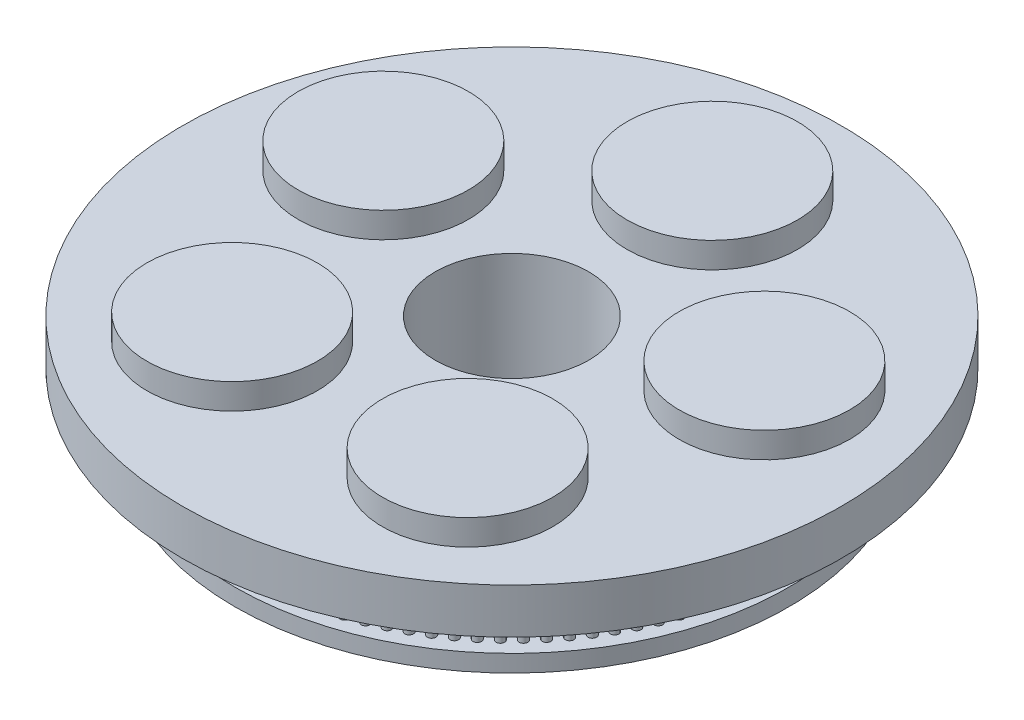
from build123d import *

# Parameters (mm, degrees)
SKETCH_1_R               = 38.66
SKETCH_1_R_2             = 9
EXTRUDE_1_DEPTH          = 5.3
SKETCH_2_R               = 10
EXTRUDE_2_DEPTH          = 3
PATTERN_CIRCULAR_1_COUNT = 5
EXTRUDE_3_DEPTH          = 6
SKETCH_5_R               = 32.5
EXTRUDE_4_DEPTH          = 2
SKETCH_6_R               = 9
CUT_EXTRUDE_1_DEPTH      = 58.051566149


with BuildPart() as part:
    # 草圖1 → 填料-伸長1 (new body)
    with BuildSketch(Plane(origin=(0, 0, 0), x_dir=(1, 0, 0), z_dir=(0, 1, 0))):
        Circle(SKETCH_1_R)
        Circle(SKETCH_1_R_2, mode=Mode.SUBTRACT)
    extrude(amount=EXTRUDE_1_DEPTH)

    # 草圖2 → 填料-伸長2 (add)
    with BuildSketch(Plane(origin=(0, 5.3, 0), x_dir=(1, 0, 0), z_dir=(0, 1, 0))):
        with Locations((0, 23.5)):
            Circle(SKETCH_2_R)
    extrude_2 = extrude(amount=EXTRUDE_2_DEPTH)

    # 環狀複製排列1: 填料-伸長2 ×5 about axis
    pattern_circular_1_axis = Axis((0, 0, 0), (0, 1, 0))
    for i in range(1, PATTERN_CIRCULAR_1_COUNT):
        add(extrude_2.rotate(pattern_circular_1_axis, i * 360 / PATTERN_CIRCULAR_1_COUNT))

    # 草圖4 → 填料-伸長3 (add)
    with BuildSketch(Plane.XZ):
        with BuildLine():
            ThreePointArc((0.5, 30.56), (0, 31.06), (-0.5, 30.56))
            Line((-0.5, 30.56), (-0.5, 30.41))
            ThreePointArc((-0.5, 30.41), (-0.619677877, 30.114749996), (-0.911156829, 29.986160028))
            ThreePointArc((-0.911156829, 29.986160028), (-0.942322772, 29.985196811), (-0.973487698, 29.984201202))
            ThreePointArc((-0.973487698, 29.984201202), (-1.272465713, 30.094235312), (-1.410446335, 30.381388071))
            Line((-1.410446335, 30.381388071), (-1.419864913, 30.531092081))
            ThreePointArc((-1.419864913, 30.531092081), (-1.950273537, 30.998710185), (-2.417891641, 30.468301561))
            Line((-2.417891641, 30.468301561), (-2.408473063, 30.318597552))
            ThreePointArc((-2.408473063, 30.318597552), (-2.509375882, 30.01641552), (-2.792205436, 29.86977718))
            ThreePointArc((-2.792205436, 29.86977718), (-2.8232494, 29.866858938), (-2.854290313, 29.863908432))
            ThreePointArc((-2.854290313, 29.863908432), (-3.159587463, 29.954952429), (-3.315326282, 30.232874684))
            Line((-3.315326282, 30.232874684), (-3.334126267, 30.381691889))
            ThreePointArc((-3.334126267, 30.381691889), (-3.892850235, 30.815082623), (-4.326240968, 30.256358655))
            Line((-4.326240968, 30.256358655), (-4.307440983, 30.10754145))
            ThreePointArc((-4.307440983, 30.10754145), (-4.389170527, 29.799619965), (-4.662234484, 29.635511968))
            ThreePointArc((-4.662234484, 29.635511968), (-4.693033951, 29.630650218), (-4.723828349, 29.625756458))
            ThreePointArc((-4.723828349, 29.625756458), (-5.034239764, 29.697451035), (-5.207122151, 29.965045952))
            Line((-5.207122151, 29.965045952), (-5.235229348, 30.11238904))
            ThreePointArc((-5.235229348, 30.11238904), (-5.820063631, 30.509842008), (-6.217516599, 29.925007725))
            Line((-6.217516599, 29.925007725), (-6.189409402, 29.777664637))
            ThreePointArc((-6.189409402, 29.777664637), (-6.251643121, 29.465218925), (-6.513863822, 29.28428893))
            ThreePointArc((-6.513863822, 29.28428893), (-6.544297242, 29.277502858), (-6.574723592, 29.270685159))
            ThreePointArc((-6.574723592, 29.270685159), (-6.889024221, 29.322747369), (-7.078367888, 29.578958874))
            Line((-7.078367888, 29.578958874), (-7.115671371, 29.724246348))
            ThreePointArc((-7.115671371, 29.724246348), (-7.724307895, 30.084192985), (-8.084254532, 29.475556461))
            Line((-8.084254532, 29.475556461), (-8.046951049, 29.330268986))
            ThreePointArc((-8.046951049, 29.330268986), (-8.089443336, 29.014532126), (-8.339785916, 28.817494181))
            ThreePointArc((-8.339785916, 28.817494181), (-8.369733181, 28.80881057), (-8.399671405, 28.800095838))
            ThreePointArc((-8.399671405, 28.800095838), (-8.716620847, 28.832320215), (-8.921678541, 29.076137158))
            Line((-8.921678541, 29.076137158), (-8.96803109, 29.218795635))
            ThreePointArc((-8.96803109, 29.218795635), (-9.598067845, 29.539815396), (-9.919087606, 28.909778641))
            Line((-9.919087606, 28.909778641), (-9.872735057, 28.767120163))
            ThreePointArc((-9.872735057, 28.767120163), (-9.895318213, 28.449338225), (-10.132794684, 28.236969949))
            ThreePointArc((-10.132794684, 28.236969949), (-10.162137607, 28.226423069), (-10.191469553, 28.215845696))
            ThreePointArc((-10.191469553, 28.215845696), (-10.509816952, 28.228105066), (-10.729779404, 28.458565212))
            Line((-10.729779404, 28.458565212), (-10.784998087, 28.598031685))
            ThreePointArc((-10.784998087, 28.598031685), (-11.433948606, 28.878857652), (-11.714774573, 28.229907132))
            Line((-11.714774573, 28.229907132), (-11.65955589, 28.09044066))
            ThreePointArc((-11.65955589, 28.09044066), (-11.66214079, 27.771867783), (-11.885813942, 27.545007296))
            ThreePointArc((-11.885813942, 27.545007296), (-11.914436719, 27.532638771), (-11.943046626, 27.520240502))
            ThreePointArc((-11.943046626, 27.520240502), (-12.261535612, 27.512486482), (-12.49553473, 27.728680311))
            Line((-12.49553473, 27.728680311), (-12.559401624, 27.864404369))
            ThreePointArc((-12.559401624, 27.864404369), (-13.224704796, 28.10392825), (-13.464228676, 27.438625078))
            Line((-13.464228676, 27.438625078), (-13.400361783, 27.30290102))
            ThreePointArc((-13.400361783, 27.30290102), (-13.382938226, 26.984794467), (-13.591925321, 26.744337084))
            ThreePointArc((-13.591925321, 26.744337084), (-13.619714992, 26.730195726), (-13.64748995, 26.716025492))
            ThreePointArc((-13.64748995, 26.716025492), (-13.964863592, 26.688288683), (-14.211975889, 26.889362977))
            Line((-14.211975889, 26.889362977), (-14.284238941, 27.020808979))
            ThreePointArc((-14.284238941, 27.020808979), (-14.963269118, 27.218085482), (-15.160545621, 26.539055305))
            Line((-15.160545621, 26.539055305), (-15.088282569, 26.407609303))
            ThreePointArc((-15.088282569, 26.407609303), (-15.050919318, 26.091224495), (-15.244395582, 25.838119191))
            ThreePointArc((-15.244395582, 25.838119191), (-15.271242473, 25.82226081), (-15.298072866, 25.806374534))
            ThreePointArc((-15.298072866, 25.806374534), (-15.613078635, 25.758764402), (-15.872328873, 25.943925612))
            Line((-15.872328873, 25.943925612), (-15.952702892, 26.070574801))
            ThreePointArc((-15.952702892, 26.070574801), (-16.642780252, 26.224825366), (-16.797030817, 25.534748006))
            Line((-16.797030817, 25.534748006), (-16.716656798, 25.408098817))
            ThreePointArc((-16.716656798, 25.408098817), (-16.659501308, 25.09468438), (-16.836703177, 24.829930047))
            ThreePointArc((-16.836703177, 24.829930047), (-16.862501336, 24.812417228), (-16.888281278, 24.794877605))
            ThreePointArc((-16.888281278, 24.794877605), (-17.19967599, 24.727582045), (-17.470041025, 24.896099425))
            Line((-17.470041025, 24.896099425), (-17.558208813, 25.017451974))
            ThreePointArc((-17.558208813, 25.017451974), (-18.256609936, 25.128067845), (-18.367225807, 24.429666722))
            Line((-18.367225807, 24.429666722), (-18.279058019, 24.308314173))
            ThreePointArc((-18.279058019, 24.308314173), (-18.202335858, 23.999107011), (-18.362563997, 23.723748512))
            ThreePointArc((-18.362563997, 23.723748512), (-18.38721161, 23.704650371), (-18.411839359, 23.685526623))
            ThreePointArc((-18.411839359, 23.685526623), (-18.718394082, 23.598811219), (-18.998806907, 23.750019708))
            Line((-18.998806907, 23.750019708), (-19.094420505, 23.865596694))
            ThreePointArc((-19.094420505, 23.865596694), (-19.798389122, 23.932141321), (-19.864933748, 23.228172704))
            Line((-19.864933748, 23.228172704), (-19.76932015, 23.112595718))
            ThreePointArc((-19.76932015, 23.112595718), (-19.673334103, 22.80881613), (-19.815956165, 22.52394018))
            ThreePointArc((-19.815956165, 22.52394018), (-19.83935596, 22.503332089), (-19.862734322, 22.482699688))
            ThreePointArc((-19.862734322, 22.482699688), (-20.163239224, 22.376906667), (-20.452593178, 22.510209513))
            Line((-20.452593178, 22.510209513), (-20.555275243, 22.619554807))
            ThreePointArc((-20.555275243, 22.619554807), (-21.26203311, 22.641765568), (-21.284243871, 21.935007701))
            Line((-21.284243871, 21.935007701), (-21.181561805, 21.825662407))
            ThreePointArc((-21.181561805, 21.825662407), (-21.066690687, 21.528509272), (-21.191143808, 21.235240147))
            ThreePointArc((-21.191143808, 21.235240147), (-21.213203436, 21.213203436), (-21.235240147, 21.191143808))
            ThreePointArc((-21.235240147, 21.191143808), (-21.528509272, 21.066690687), (-21.825662407, 21.181561805))
            Line((-21.825662407, 21.181561805), (-21.935007701, 21.284243871))
            ThreePointArc((-21.935007701, 21.284243871), (-22.641765568, 21.26203311), (-22.619554807, 20.555275243))
            Line((-22.619554807, 20.555275243), (-22.510209513, 20.452593178))
            ThreePointArc((-22.510209513, 20.452593178), (-22.376906667, 20.163239224), (-22.482699688, 19.862734322))
            ThreePointArc((-22.482699688, 19.862734322), (-22.503332089, 19.83935596), (-22.52394018, 19.815956165))
            ThreePointArc((-22.52394018, 19.815956165), (-22.80881613, 19.673334103), (-23.112595718, 19.76932015))
            Line((-23.112595718, 19.76932015), (-23.228172704, 19.864933748))
            ThreePointArc((-23.228172704, 19.864933748), (-23.932141321, 19.798389122), (-23.865596694, 19.094420505))
            Line((-23.865596694, 19.094420505), (-23.750019708, 18.998806907))
            ThreePointArc((-23.750019708, 18.998806907), (-23.598811219, 18.718394082), (-23.685526623, 18.411839359))
            ThreePointArc((-23.685526623, 18.411839359), (-23.704650371, 18.38721161), (-23.723748512, 18.362563997))
            ThreePointArc((-23.723748512, 18.362563997), (-23.999107011, 18.202335858), (-24.308314173, 18.279058019))
            Line((-24.308314173, 18.279058019), (-24.429666722, 18.367225807))
            ThreePointArc((-24.429666722, 18.367225807), (-25.128067845, 18.256609936), (-25.017451974, 17.558208813))
            Line((-25.017451974, 17.558208813), (-24.896099425, 17.470041025))
            ThreePointArc((-24.896099425, 17.470041025), (-24.727582045, 17.19967599), (-24.794877605, 16.888281278))
            ThreePointArc((-24.794877605, 16.888281278), (-24.812417228, 16.862501336), (-24.829930047, 16.836703177))
            ThreePointArc((-24.829930047, 16.836703177), (-25.09468438, 16.659501308), (-25.408098817, 16.716656798))
            Line((-25.408098817, 16.716656798), (-25.534748006, 16.797030817))
            ThreePointArc((-25.534748006, 16.797030817), (-26.224825366, 16.642780252), (-26.070574801, 15.952702892))
            Line((-26.070574801, 15.952702892), (-25.943925612, 15.872328873))
            ThreePointArc((-25.943925612, 15.872328873), (-25.758764402, 15.613078635), (-25.806374534, 15.298072866))
            ThreePointArc((-25.806374534, 15.298072866), (-25.82226081, 15.271242473), (-25.838119191, 15.244395582))
            ThreePointArc((-25.838119191, 15.244395582), (-26.091224495, 15.050919318), (-26.407609303, 15.088282569))
            Line((-26.407609303, 15.088282569), (-26.539055305, 15.160545621))
            ThreePointArc((-26.539055305, 15.160545621), (-27.218085482, 14.963269118), (-27.020808979, 14.284238941))
            Line((-27.020808979, 14.284238941), (-26.889362977, 14.211975889))
            ThreePointArc((-26.889362977, 14.211975889), (-26.688288683, 13.964863592), (-26.716025492, 13.64748995))
            ThreePointArc((-26.716025492, 13.64748995), (-26.730195726, 13.619714992), (-26.744337084, 13.591925321))
            ThreePointArc((-26.744337084, 13.591925321), (-26.984794467, 13.382938226), (-27.30290102, 13.400361783))
            Line((-27.30290102, 13.400361783), (-27.438625078, 13.464228676))
            ThreePointArc((-27.438625078, 13.464228676), (-28.10392825, 13.224704796), (-27.864404369, 12.559401624))
            Line((-27.864404369, 12.559401624), (-27.728680311, 12.49553473))
            ThreePointArc((-27.728680311, 12.49553473), (-27.512486482, 12.261535612), (-27.520240502, 11.943046626))
            ThreePointArc((-27.520240502, 11.943046626), (-27.532638771, 11.914436719), (-27.545007296, 11.885813942))
            ThreePointArc((-27.545007296, 11.885813942), (-27.771867783, 11.66214079), (-28.09044066, 11.65955589))
            Line((-28.09044066, 11.65955589), (-28.229907132, 11.714774573))
            ThreePointArc((-28.229907132, 11.714774573), (-28.878857652, 11.433948606), (-28.598031685, 10.784998087))
            Line((-28.598031685, 10.784998087), (-28.458565212, 10.729779404))
            ThreePointArc((-28.458565212, 10.729779404), (-28.228105066, 10.509816952), (-28.215845696, 10.191469553))
            ThreePointArc((-28.215845696, 10.191469553), (-28.226423069, 10.162137607), (-28.236969949, 10.132794684))
            ThreePointArc((-28.236969949, 10.132794684), (-28.449338225, 9.895318213), (-28.767120163, 9.872735057))
            Line((-28.767120163, 9.872735057), (-28.909778641, 9.919087606))
            ThreePointArc((-28.909778641, 9.919087606), (-29.539815396, 9.598067845), (-29.218795635, 8.96803109))
            Line((-29.218795635, 8.96803109), (-29.076137158, 8.921678541))
            ThreePointArc((-29.076137158, 8.921678541), (-28.832320215, 8.716620847), (-28.800095838, 8.399671405))
            ThreePointArc((-28.800095838, 8.399671405), (-28.80881057, 8.369733181), (-28.817494181, 8.339785916))
            ThreePointArc((-28.817494181, 8.339785916), (-29.014532126, 8.089443336), (-29.330268986, 8.046951049))
            Line((-29.330268986, 8.046951049), (-29.475556461, 8.084254532))
            ThreePointArc((-29.475556461, 8.084254532), (-30.084192985, 7.724307895), (-29.724246348, 7.115671371))
            Line((-29.724246348, 7.115671371), (-29.578958874, 7.078367888))
            ThreePointArc((-29.578958874, 7.078367888), (-29.322747369, 6.889024221), (-29.270685159, 6.574723592))
            ThreePointArc((-29.270685159, 6.574723592), (-29.277502858, 6.544297242), (-29.28428893, 6.513863822))
            ThreePointArc((-29.28428893, 6.513863822), (-29.465218925, 6.251643121), (-29.777664637, 6.189409402))
            Line((-29.777664637, 6.189409402), (-29.925007725, 6.217516599))
            ThreePointArc((-29.925007725, 6.217516599), (-30.509842008, 5.820063631), (-30.11238904, 5.235229348))
            Line((-30.11238904, 5.235229348), (-29.965045952, 5.207122151))
            ThreePointArc((-29.965045952, 5.207122151), (-29.697451035, 5.034239764), (-29.625756458, 4.723828349))
            ThreePointArc((-29.625756458, 4.723828349), (-29.630650218, 4.693033951), (-29.635511968, 4.662234484))
            ThreePointArc((-29.635511968, 4.662234484), (-29.799619965, 4.389170527), (-30.10754145, 4.307440983))
            Line((-30.10754145, 4.307440983), (-30.256358655, 4.326240968))
            ThreePointArc((-30.256358655, 4.326240968), (-30.815082623, 3.892850235), (-30.381691889, 3.334126267))
            Line((-30.381691889, 3.334126267), (-30.232874684, 3.315326282))
            ThreePointArc((-30.232874684, 3.315326282), (-29.954952429, 3.159587463), (-29.863908432, 2.854290313))
            ThreePointArc((-29.863908432, 2.854290313), (-29.866858938, 2.8232494), (-29.86977718, 2.792205436))
            ThreePointArc((-29.86977718, 2.792205436), (-30.01641552, 2.509375882), (-30.318597552, 2.408473063))
            Line((-30.318597552, 2.408473063), (-30.468301561, 2.417891641))
            ThreePointArc((-30.468301561, 2.417891641), (-30.998710185, 1.950273537), (-30.531092081, 1.419864913))
            Line((-30.531092081, 1.419864913), (-30.381388071, 1.410446335))
            ThreePointArc((-30.381388071, 1.410446335), (-30.094235312, 1.272465713), (-29.984201202, 0.973487698))
            ThreePointArc((-29.984201202, 0.973487698), (-29.985196811, 0.942322772), (-29.986160028, 0.911156829))
            ThreePointArc((-29.986160028, 0.911156829), (-30.114749996, 0.619677877), (-30.41, 0.5))
            Line((-30.41, 0.5), (-30.56, 0.5))
            ThreePointArc((-30.56, 0.5), (-31.06, 0), (-30.56, -0.5))
            Line((-30.56, -0.5), (-30.41, -0.5))
            ThreePointArc((-30.41, -0.5), (-30.114749996, -0.619677877), (-29.986160028, -0.911156829))
            ThreePointArc((-29.986160028, -0.911156829), (-29.985196811, -0.942322772), (-29.984201202, -0.973487698))
            ThreePointArc((-29.984201202, -0.973487698), (-30.094235312, -1.272465713), (-30.381388071, -1.410446335))
            Line((-30.381388071, -1.410446335), (-30.531092081, -1.419864913))
            ThreePointArc((-30.531092081, -1.419864913), (-30.998710185, -1.950273537), (-30.468301561, -2.417891641))
            Line((-30.468301561, -2.417891641), (-30.318597552, -2.408473063))
            ThreePointArc((-30.318597552, -2.408473063), (-30.01641552, -2.509375882), (-29.86977718, -2.792205436))
            ThreePointArc((-29.86977718, -2.792205436), (-29.866858938, -2.8232494), (-29.863908432, -2.854290313))
            ThreePointArc((-29.863908432, -2.854290313), (-29.954952429, -3.159587463), (-30.232874684, -3.315326282))
            Line((-30.232874684, -3.315326282), (-30.381691889, -3.334126267))
            ThreePointArc((-30.381691889, -3.334126267), (-30.815082623, -3.892850235), (-30.256358655, -4.326240968))
            Line((-30.256358655, -4.326240968), (-30.10754145, -4.307440983))
            ThreePointArc((-30.10754145, -4.307440983), (-29.799619965, -4.389170527), (-29.635511968, -4.662234484))
            ThreePointArc((-29.635511968, -4.662234484), (-29.630650218, -4.693033951), (-29.625756458, -4.723828349))
            ThreePointArc((-29.625756458, -4.723828349), (-29.697451035, -5.034239764), (-29.965045952, -5.207122151))
            Line((-29.965045952, -5.207122151), (-30.11238904, -5.235229348))
            ThreePointArc((-30.11238904, -5.235229348), (-30.509842008, -5.820063631), (-29.925007725, -6.217516599))
            Line((-29.925007725, -6.217516599), (-29.777664637, -6.189409402))
            ThreePointArc((-29.777664637, -6.189409402), (-29.465218925, -6.251643121), (-29.28428893, -6.513863822))
            ThreePointArc((-29.28428893, -6.513863822), (-29.277502858, -6.544297242), (-29.270685159, -6.574723592))
            ThreePointArc((-29.270685159, -6.574723592), (-29.322747369, -6.889024221), (-29.578958874, -7.078367888))
            Line((-29.578958874, -7.078367888), (-29.724246348, -7.115671371))
            ThreePointArc((-29.724246348, -7.115671371), (-30.084192985, -7.724307895), (-29.475556461, -8.084254532))
            Line((-29.475556461, -8.084254532), (-29.330268986, -8.046951049))
            ThreePointArc((-29.330268986, -8.046951049), (-29.014532126, -8.089443336), (-28.817494181, -8.339785916))
            ThreePointArc((-28.817494181, -8.339785916), (-28.80881057, -8.369733181), (-28.800095838, -8.399671405))
            ThreePointArc((-28.800095838, -8.399671405), (-28.832320215, -8.716620847), (-29.076137158, -8.921678541))
            Line((-29.076137158, -8.921678541), (-29.218795635, -8.96803109))
            ThreePointArc((-29.218795635, -8.96803109), (-29.539815396, -9.598067845), (-28.909778641, -9.919087606))
            Line((-28.909778641, -9.919087606), (-28.767120163, -9.872735057))
            ThreePointArc((-28.767120163, -9.872735057), (-28.449338225, -9.895318213), (-28.236969949, -10.132794684))
            ThreePointArc((-28.236969949, -10.132794684), (-28.226423069, -10.162137607), (-28.215845696, -10.191469553))
            ThreePointArc((-28.215845696, -10.191469553), (-28.228105066, -10.509816952), (-28.458565212, -10.729779404))
            Line((-28.458565212, -10.729779404), (-28.598031685, -10.784998087))
            ThreePointArc((-28.598031685, -10.784998087), (-28.878857652, -11.433948606), (-28.229907132, -11.714774573))
            Line((-28.229907132, -11.714774573), (-28.09044066, -11.65955589))
            ThreePointArc((-28.09044066, -11.65955589), (-27.771867783, -11.66214079), (-27.545007296, -11.885813942))
            ThreePointArc((-27.545007296, -11.885813942), (-27.532638771, -11.914436719), (-27.520240502, -11.943046626))
            ThreePointArc((-27.520240502, -11.943046626), (-27.512486482, -12.261535612), (-27.728680311, -12.49553473))
            Line((-27.728680311, -12.49553473), (-27.864404369, -12.559401624))
            ThreePointArc((-27.864404369, -12.559401624), (-28.10392825, -13.224704796), (-27.438625078, -13.464228676))
            Line((-27.438625078, -13.464228676), (-27.30290102, -13.400361783))
            ThreePointArc((-27.30290102, -13.400361783), (-26.984794467, -13.382938226), (-26.744337084, -13.591925321))
            ThreePointArc((-26.744337084, -13.591925321), (-26.730195726, -13.619714992), (-26.716025492, -13.64748995))
            ThreePointArc((-26.716025492, -13.64748995), (-26.688288683, -13.964863592), (-26.889362977, -14.211975889))
            Line((-26.889362977, -14.211975889), (-27.020808979, -14.284238941))
            ThreePointArc((-27.020808979, -14.284238941), (-27.218085482, -14.963269118), (-26.539055305, -15.160545621))
            Line((-26.539055305, -15.160545621), (-26.407609303, -15.088282569))
            ThreePointArc((-26.407609303, -15.088282569), (-26.091224495, -15.050919318), (-25.838119191, -15.244395582))
            ThreePointArc((-25.838119191, -15.244395582), (-25.82226081, -15.271242473), (-25.806374534, -15.298072866))
            ThreePointArc((-25.806374534, -15.298072866), (-25.758764402, -15.613078635), (-25.943925612, -15.872328873))
            Line((-25.943925612, -15.872328873), (-26.070574801, -15.952702892))
            ThreePointArc((-26.070574801, -15.952702892), (-26.224825366, -16.642780252), (-25.534748006, -16.797030817))
            Line((-25.534748006, -16.797030817), (-25.408098817, -16.716656798))
            ThreePointArc((-25.408098817, -16.716656798), (-25.09468438, -16.659501308), (-24.829930047, -16.836703177))
            ThreePointArc((-24.829930047, -16.836703177), (-24.812417228, -16.862501336), (-24.794877605, -16.888281278))
            ThreePointArc((-24.794877605, -16.888281278), (-24.727582045, -17.19967599), (-24.896099425, -17.470041025))
            Line((-24.896099425, -17.470041025), (-25.017451974, -17.558208813))
            ThreePointArc((-25.017451974, -17.558208813), (-25.128067845, -18.256609936), (-24.429666722, -18.367225807))
            Line((-24.429666722, -18.367225807), (-24.308314173, -18.279058019))
            ThreePointArc((-24.308314173, -18.279058019), (-23.999107011, -18.202335858), (-23.723748512, -18.362563997))
            ThreePointArc((-23.723748512, -18.362563997), (-23.704650371, -18.38721161), (-23.685526623, -18.411839359))
            ThreePointArc((-23.685526623, -18.411839359), (-23.598811219, -18.718394082), (-23.750019708, -18.998806907))
            Line((-23.750019708, -18.998806907), (-23.865596694, -19.094420505))
            ThreePointArc((-23.865596694, -19.094420505), (-23.932141321, -19.798389122), (-23.228172704, -19.864933748))
            Line((-23.228172704, -19.864933748), (-23.112595718, -19.76932015))
            ThreePointArc((-23.112595718, -19.76932015), (-22.80881613, -19.673334103), (-22.52394018, -19.815956165))
            ThreePointArc((-22.52394018, -19.815956165), (-22.503332089, -19.83935596), (-22.482699688, -19.862734322))
            ThreePointArc((-22.482699688, -19.862734322), (-22.376906667, -20.163239224), (-22.510209513, -20.452593178))
            Line((-22.510209513, -20.452593178), (-22.619554807, -20.555275243))
            ThreePointArc((-22.619554807, -20.555275243), (-22.641765568, -21.26203311), (-21.935007701, -21.284243871))
            Line((-21.935007701, -21.284243871), (-21.825662407, -21.181561805))
            ThreePointArc((-21.825662407, -21.181561805), (-21.528509272, -21.066690687), (-21.235240147, -21.191143808))
            ThreePointArc((-21.235240147, -21.191143808), (-21.213203436, -21.213203436), (-21.191143808, -21.235240147))
            ThreePointArc((-21.191143808, -21.235240147), (-21.066690687, -21.528509272), (-21.181561805, -21.825662407))
            Line((-21.181561805, -21.825662407), (-21.284243871, -21.935007701))
            ThreePointArc((-21.284243871, -21.935007701), (-21.26203311, -22.641765568), (-20.555275243, -22.619554807))
            Line((-20.555275243, -22.619554807), (-20.452593178, -22.510209513))
            ThreePointArc((-20.452593178, -22.510209513), (-20.163239224, -22.376906667), (-19.862734322, -22.482699688))
            ThreePointArc((-19.862734322, -22.482699688), (-19.83935596, -22.503332089), (-19.815956165, -22.52394018))
            ThreePointArc((-19.815956165, -22.52394018), (-19.673334103, -22.80881613), (-19.76932015, -23.112595718))
            Line((-19.76932015, -23.112595718), (-19.864933748, -23.228172704))
            ThreePointArc((-19.864933748, -23.228172704), (-19.798389122, -23.932141321), (-19.094420505, -23.865596694))
            Line((-19.094420505, -23.865596694), (-18.998806907, -23.750019708))
            ThreePointArc((-18.998806907, -23.750019708), (-18.718394082, -23.598811219), (-18.411839359, -23.685526623))
            ThreePointArc((-18.411839359, -23.685526623), (-18.38721161, -23.704650371), (-18.362563997, -23.723748512))
            ThreePointArc((-18.362563997, -23.723748512), (-18.202335858, -23.999107011), (-18.279058019, -24.308314173))
            Line((-18.279058019, -24.308314173), (-18.367225807, -24.429666722))
            ThreePointArc((-18.367225807, -24.429666722), (-18.256609936, -25.128067845), (-17.558208813, -25.017451974))
            Line((-17.558208813, -25.017451974), (-17.470041025, -24.896099425))
            ThreePointArc((-17.470041025, -24.896099425), (-17.19967599, -24.727582045), (-16.888281278, -24.794877605))
            ThreePointArc((-16.888281278, -24.794877605), (-16.862501336, -24.812417228), (-16.836703177, -24.829930047))
            ThreePointArc((-16.836703177, -24.829930047), (-16.659501308, -25.09468438), (-16.716656798, -25.408098817))
            Line((-16.716656798, -25.408098817), (-16.797030817, -25.534748006))
            ThreePointArc((-16.797030817, -25.534748006), (-16.642780252, -26.224825366), (-15.952702892, -26.070574801))
            Line((-15.952702892, -26.070574801), (-15.872328873, -25.943925612))
            ThreePointArc((-15.872328873, -25.943925612), (-15.613078635, -25.758764402), (-15.298072866, -25.806374534))
            ThreePointArc((-15.298072866, -25.806374534), (-15.271242473, -25.82226081), (-15.244395582, -25.838119191))
            ThreePointArc((-15.244395582, -25.838119191), (-15.050919318, -26.091224495), (-15.088282569, -26.407609303))
            Line((-15.088282569, -26.407609303), (-15.160545621, -26.539055305))
            ThreePointArc((-15.160545621, -26.539055305), (-14.963269118, -27.218085482), (-14.284238941, -27.020808979))
            Line((-14.284238941, -27.020808979), (-14.211975889, -26.889362977))
            ThreePointArc((-14.211975889, -26.889362977), (-13.964863592, -26.688288683), (-13.64748995, -26.716025492))
            ThreePointArc((-13.64748995, -26.716025492), (-13.619714992, -26.730195726), (-13.591925321, -26.744337084))
            ThreePointArc((-13.591925321, -26.744337084), (-13.382938226, -26.984794467), (-13.400361783, -27.30290102))
            Line((-13.400361783, -27.30290102), (-13.464228676, -27.438625078))
            ThreePointArc((-13.464228676, -27.438625078), (-13.224704796, -28.10392825), (-12.559401624, -27.864404369))
            Line((-12.559401624, -27.864404369), (-12.49553473, -27.728680311))
            ThreePointArc((-12.49553473, -27.728680311), (-12.261535612, -27.512486482), (-11.943046626, -27.520240502))
            ThreePointArc((-11.943046626, -27.520240502), (-11.914436719, -27.532638771), (-11.885813942, -27.545007296))
            ThreePointArc((-11.885813942, -27.545007296), (-11.66214079, -27.771867783), (-11.65955589, -28.09044066))
            Line((-11.65955589, -28.09044066), (-11.714774573, -28.229907132))
            ThreePointArc((-11.714774573, -28.229907132), (-11.433948606, -28.878857652), (-10.784998087, -28.598031685))
            Line((-10.784998087, -28.598031685), (-10.729779404, -28.458565212))
            ThreePointArc((-10.729779404, -28.458565212), (-10.509816952, -28.228105066), (-10.191469553, -28.215845696))
            ThreePointArc((-10.191469553, -28.215845696), (-10.162137607, -28.226423069), (-10.132794684, -28.236969949))
            ThreePointArc((-10.132794684, -28.236969949), (-9.895318213, -28.449338225), (-9.872735057, -28.767120163))
            Line((-9.872735057, -28.767120163), (-9.919087606, -28.909778641))
            ThreePointArc((-9.919087606, -28.909778641), (-9.598067845, -29.539815396), (-8.96803109, -29.218795635))
            Line((-8.96803109, -29.218795635), (-8.921678541, -29.076137158))
            ThreePointArc((-8.921678541, -29.076137158), (-8.716620847, -28.832320215), (-8.399671405, -28.800095838))
            ThreePointArc((-8.399671405, -28.800095838), (-8.369733181, -28.80881057), (-8.339785916, -28.817494181))
            ThreePointArc((-8.339785916, -28.817494181), (-8.089443336, -29.014532126), (-8.046951049, -29.330268986))
            Line((-8.046951049, -29.330268986), (-8.084254532, -29.475556461))
            ThreePointArc((-8.084254532, -29.475556461), (-7.724307895, -30.084192985), (-7.115671371, -29.724246348))
            Line((-7.115671371, -29.724246348), (-7.078367888, -29.578958874))
            ThreePointArc((-7.078367888, -29.578958874), (-6.889024221, -29.322747369), (-6.574723592, -29.270685159))
            ThreePointArc((-6.574723592, -29.270685159), (-6.544297242, -29.277502858), (-6.513863822, -29.28428893))
            ThreePointArc((-6.513863822, -29.28428893), (-6.251643121, -29.465218925), (-6.189409402, -29.777664637))
            Line((-6.189409402, -29.777664637), (-6.217516599, -29.925007725))
            ThreePointArc((-6.217516599, -29.925007725), (-5.820063631, -30.509842008), (-5.235229348, -30.11238904))
            Line((-5.235229348, -30.11238904), (-5.207122151, -29.965045952))
            ThreePointArc((-5.207122151, -29.965045952), (-5.034239764, -29.697451035), (-4.723828349, -29.625756458))
            ThreePointArc((-4.723828349, -29.625756458), (-4.693033951, -29.630650218), (-4.662234484, -29.635511968))
            ThreePointArc((-4.662234484, -29.635511968), (-4.389170527, -29.799619965), (-4.307440983, -30.10754145))
            Line((-4.307440983, -30.10754145), (-4.326240968, -30.256358655))
            ThreePointArc((-4.326240968, -30.256358655), (-3.892850235, -30.815082623), (-3.334126267, -30.381691889))
            Line((-3.334126267, -30.381691889), (-3.315326282, -30.232874684))
            ThreePointArc((-3.315326282, -30.232874684), (-3.159587463, -29.954952429), (-2.854290313, -29.863908432))
            ThreePointArc((-2.854290313, -29.863908432), (-2.8232494, -29.866858938), (-2.792205436, -29.86977718))
            ThreePointArc((-2.792205436, -29.86977718), (-2.509375882, -30.01641552), (-2.408473063, -30.318597552))
            Line((-2.408473063, -30.318597552), (-2.417891641, -30.468301561))
            ThreePointArc((-2.417891641, -30.468301561), (-1.950273537, -30.998710185), (-1.419864913, -30.531092081))
            Line((-1.419864913, -30.531092081), (-1.410446335, -30.381388071))
            ThreePointArc((-1.410446335, -30.381388071), (-1.272465713, -30.094235312), (-0.973487698, -29.984201202))
            ThreePointArc((-0.973487698, -29.984201202), (-0.942322772, -29.985196811), (-0.911156829, -29.986160028))
            ThreePointArc((-0.911156829, -29.986160028), (-0.619677877, -30.114749996), (-0.5, -30.41))
            Line((-0.5, -30.41), (-0.5, -30.56))
            ThreePointArc((-0.5, -30.56), (0, -31.06), (0.5, -30.56))
            Line((0.5, -30.56), (0.5, -30.41))
            ThreePointArc((0.5, -30.41), (0.619677877, -30.114749996), (0.911156829, -29.986160028))
            ThreePointArc((0.911156829, -29.986160028), (0.942322772, -29.985196811), (0.973487698, -29.984201202))
            ThreePointArc((0.973487698, -29.984201202), (1.272465713, -30.094235312), (1.410446335, -30.381388071))
            Line((1.410446335, -30.381388071), (1.419864913, -30.531092081))
            ThreePointArc((1.419864913, -30.531092081), (1.950273537, -30.998710185), (2.417891641, -30.468301561))
            Line((2.417891641, -30.468301561), (2.408473063, -30.318597552))
            ThreePointArc((2.408473063, -30.318597552), (2.509375882, -30.01641552), (2.792205436, -29.86977718))
            ThreePointArc((2.792205436, -29.86977718), (2.8232494, -29.866858938), (2.854290313, -29.863908432))
            ThreePointArc((2.854290313, -29.863908432), (3.159587463, -29.954952429), (3.315326282, -30.232874684))
            Line((3.315326282, -30.232874684), (3.334126267, -30.381691889))
            ThreePointArc((3.334126267, -30.381691889), (3.892850235, -30.815082623), (4.326240968, -30.256358655))
            Line((4.326240968, -30.256358655), (4.307440983, -30.10754145))
            ThreePointArc((4.307440983, -30.10754145), (4.389170527, -29.799619965), (4.662234484, -29.635511968))
            ThreePointArc((4.662234484, -29.635511968), (4.693033951, -29.630650218), (4.723828349, -29.625756458))
            ThreePointArc((4.723828349, -29.625756458), (5.034239764, -29.697451035), (5.207122151, -29.965045952))
            Line((5.207122151, -29.965045952), (5.235229348, -30.11238904))
            ThreePointArc((5.235229348, -30.11238904), (5.820063631, -30.509842008), (6.217516599, -29.925007725))
            Line((6.217516599, -29.925007725), (6.189409402, -29.777664637))
            ThreePointArc((6.189409402, -29.777664637), (6.251643121, -29.465218925), (6.513863822, -29.28428893))
            ThreePointArc((6.513863822, -29.28428893), (6.544297242, -29.277502858), (6.574723592, -29.270685159))
            ThreePointArc((6.574723592, -29.270685159), (6.889024221, -29.322747369), (7.078367888, -29.578958874))
            Line((7.078367888, -29.578958874), (7.115671371, -29.724246348))
            ThreePointArc((7.115671371, -29.724246348), (7.724307895, -30.084192985), (8.084254532, -29.475556461))
            Line((8.084254532, -29.475556461), (8.046951049, -29.330268986))
            ThreePointArc((8.046951049, -29.330268986), (8.089443336, -29.014532126), (8.339785916, -28.817494181))
            ThreePointArc((8.339785916, -28.817494181), (8.369733181, -28.80881057), (8.399671405, -28.800095838))
            ThreePointArc((8.399671405, -28.800095838), (8.716620847, -28.832320215), (8.921678541, -29.076137158))
            Line((8.921678541, -29.076137158), (8.96803109, -29.218795635))
            ThreePointArc((8.96803109, -29.218795635), (9.598067845, -29.539815396), (9.919087606, -28.909778641))
            Line((9.919087606, -28.909778641), (9.872735057, -28.767120163))
            ThreePointArc((9.872735057, -28.767120163), (9.895318213, -28.449338225), (10.132794684, -28.236969949))
            ThreePointArc((10.132794684, -28.236969949), (10.162137607, -28.226423069), (10.191469553, -28.215845696))
            ThreePointArc((10.191469553, -28.215845696), (10.509816952, -28.228105066), (10.729779404, -28.458565212))
            Line((10.729779404, -28.458565212), (10.784998087, -28.598031685))
            ThreePointArc((10.784998087, -28.598031685), (11.433948606, -28.878857652), (11.714774573, -28.229907132))
            Line((11.714774573, -28.229907132), (11.65955589, -28.09044066))
            ThreePointArc((11.65955589, -28.09044066), (11.66214079, -27.771867783), (11.885813942, -27.545007296))
            ThreePointArc((11.885813942, -27.545007296), (11.914436719, -27.532638771), (11.943046626, -27.520240502))
            ThreePointArc((11.943046626, -27.520240502), (12.261535612, -27.512486482), (12.49553473, -27.728680311))
            Line((12.49553473, -27.728680311), (12.559401624, -27.864404369))
            ThreePointArc((12.559401624, -27.864404369), (13.224704796, -28.10392825), (13.464228676, -27.438625078))
            Line((13.464228676, -27.438625078), (13.400361783, -27.30290102))
            ThreePointArc((13.400361783, -27.30290102), (13.382938226, -26.984794467), (13.591925321, -26.744337084))
            ThreePointArc((13.591925321, -26.744337084), (13.619714992, -26.730195726), (13.64748995, -26.716025492))
            ThreePointArc((13.64748995, -26.716025492), (13.964863592, -26.688288683), (14.211975889, -26.889362977))
            Line((14.211975889, -26.889362977), (14.284238941, -27.020808979))
            ThreePointArc((14.284238941, -27.020808979), (14.963269118, -27.218085482), (15.160545621, -26.539055305))
            Line((15.160545621, -26.539055305), (15.088282569, -26.407609303))
            ThreePointArc((15.088282569, -26.407609303), (15.050919318, -26.091224495), (15.244395582, -25.838119191))
            ThreePointArc((15.244395582, -25.838119191), (15.271242473, -25.82226081), (15.298072866, -25.806374534))
            ThreePointArc((15.298072866, -25.806374534), (15.613078635, -25.758764402), (15.872328873, -25.943925612))
            Line((15.872328873, -25.943925612), (15.952702892, -26.070574801))
            ThreePointArc((15.952702892, -26.070574801), (16.642780252, -26.224825366), (16.797030817, -25.534748006))
            Line((16.797030817, -25.534748006), (16.716656798, -25.408098817))
            ThreePointArc((16.716656798, -25.408098817), (16.659501308, -25.09468438), (16.836703177, -24.829930047))
            ThreePointArc((16.836703177, -24.829930047), (16.862501336, -24.812417228), (16.888281278, -24.794877605))
            ThreePointArc((16.888281278, -24.794877605), (17.19967599, -24.727582045), (17.470041025, -24.896099425))
            Line((17.470041025, -24.896099425), (17.558208813, -25.017451974))
            ThreePointArc((17.558208813, -25.017451974), (18.256609936, -25.128067845), (18.367225807, -24.429666722))
            Line((18.367225807, -24.429666722), (18.279058019, -24.308314173))
            ThreePointArc((18.279058019, -24.308314173), (18.202335858, -23.999107011), (18.362563997, -23.723748512))
            ThreePointArc((18.362563997, -23.723748512), (18.38721161, -23.704650371), (18.411839359, -23.685526623))
            ThreePointArc((18.411839359, -23.685526623), (18.718394082, -23.598811219), (18.998806907, -23.750019708))
            Line((18.998806907, -23.750019708), (19.094420505, -23.865596694))
            ThreePointArc((19.094420505, -23.865596694), (19.798389122, -23.932141321), (19.864933748, -23.228172704))
            Line((19.864933748, -23.228172704), (19.76932015, -23.112595718))
            ThreePointArc((19.76932015, -23.112595718), (19.673334103, -22.80881613), (19.815956165, -22.52394018))
            ThreePointArc((19.815956165, -22.52394018), (19.83935596, -22.503332089), (19.862734322, -22.482699688))
            ThreePointArc((19.862734322, -22.482699688), (20.163239224, -22.376906667), (20.452593178, -22.510209513))
            Line((20.452593178, -22.510209513), (20.555275243, -22.619554807))
            ThreePointArc((20.555275243, -22.619554807), (21.26203311, -22.641765568), (21.284243871, -21.935007701))
            Line((21.284243871, -21.935007701), (21.181561805, -21.825662407))
            ThreePointArc((21.181561805, -21.825662407), (21.066690687, -21.528509272), (21.191143808, -21.235240147))
            ThreePointArc((21.191143808, -21.235240147), (21.213203436, -21.213203436), (21.235240147, -21.191143808))
            ThreePointArc((21.235240147, -21.191143808), (21.528509272, -21.066690687), (21.825662407, -21.181561805))
            Line((21.825662407, -21.181561805), (21.935007701, -21.284243871))
            ThreePointArc((21.935007701, -21.284243871), (22.641765568, -21.26203311), (22.619554807, -20.555275243))
            Line((22.619554807, -20.555275243), (22.510209513, -20.452593178))
            ThreePointArc((22.510209513, -20.452593178), (22.376906667, -20.163239224), (22.482699688, -19.862734322))
            ThreePointArc((22.482699688, -19.862734322), (22.503332089, -19.83935596), (22.52394018, -19.815956165))
            ThreePointArc((22.52394018, -19.815956165), (22.80881613, -19.673334103), (23.112595718, -19.76932015))
            Line((23.112595718, -19.76932015), (23.228172704, -19.864933748))
            ThreePointArc((23.228172704, -19.864933748), (23.932141321, -19.798389122), (23.865596694, -19.094420505))
            Line((23.865596694, -19.094420505), (23.750019708, -18.998806907))
            ThreePointArc((23.750019708, -18.998806907), (23.598811219, -18.718394082), (23.685526623, -18.411839359))
            ThreePointArc((23.685526623, -18.411839359), (23.704650371, -18.38721161), (23.723748512, -18.362563997))
            ThreePointArc((23.723748512, -18.362563997), (23.999107011, -18.202335858), (24.308314173, -18.279058019))
            Line((24.308314173, -18.279058019), (24.429666722, -18.367225807))
            ThreePointArc((24.429666722, -18.367225807), (25.128067845, -18.256609936), (25.017451974, -17.558208813))
            Line((25.017451974, -17.558208813), (24.896099425, -17.470041025))
            ThreePointArc((24.896099425, -17.470041025), (24.727582045, -17.19967599), (24.794877605, -16.888281278))
            ThreePointArc((24.794877605, -16.888281278), (24.812417228, -16.862501336), (24.829930047, -16.836703177))
            ThreePointArc((24.829930047, -16.836703177), (25.09468438, -16.659501308), (25.408098817, -16.716656798))
            Line((25.408098817, -16.716656798), (25.534748006, -16.797030817))
            ThreePointArc((25.534748006, -16.797030817), (26.224825366, -16.642780252), (26.070574801, -15.952702892))
            Line((26.070574801, -15.952702892), (25.943925612, -15.872328873))
            ThreePointArc((25.943925612, -15.872328873), (25.758764402, -15.613078635), (25.806374534, -15.298072866))
            ThreePointArc((25.806374534, -15.298072866), (25.82226081, -15.271242473), (25.838119191, -15.244395582))
            ThreePointArc((25.838119191, -15.244395582), (26.091224495, -15.050919318), (26.407609303, -15.088282569))
            Line((26.407609303, -15.088282569), (26.539055305, -15.160545621))
            ThreePointArc((26.539055305, -15.160545621), (27.218085482, -14.963269118), (27.020808979, -14.284238941))
            Line((27.020808979, -14.284238941), (26.889362977, -14.211975889))
            ThreePointArc((26.889362977, -14.211975889), (26.688288683, -13.964863592), (26.716025492, -13.64748995))
            ThreePointArc((26.716025492, -13.64748995), (26.730195726, -13.619714992), (26.744337084, -13.591925321))
            ThreePointArc((26.744337084, -13.591925321), (26.984794467, -13.382938226), (27.30290102, -13.400361783))
            Line((27.30290102, -13.400361783), (27.438625078, -13.464228676))
            ThreePointArc((27.438625078, -13.464228676), (28.10392825, -13.224704796), (27.864404369, -12.559401624))
            Line((27.864404369, -12.559401624), (27.728680311, -12.49553473))
            ThreePointArc((27.728680311, -12.49553473), (27.512486482, -12.261535612), (27.520240502, -11.943046626))
            ThreePointArc((27.520240502, -11.943046626), (27.532638771, -11.914436719), (27.545007296, -11.885813942))
            ThreePointArc((27.545007296, -11.885813942), (27.771867783, -11.66214079), (28.09044066, -11.65955589))
            Line((28.09044066, -11.65955589), (28.229907132, -11.714774573))
            ThreePointArc((28.229907132, -11.714774573), (28.878857652, -11.433948606), (28.598031685, -10.784998087))
            Line((28.598031685, -10.784998087), (28.458565212, -10.729779404))
            ThreePointArc((28.458565212, -10.729779404), (28.228105066, -10.509816952), (28.215845696, -10.191469553))
            ThreePointArc((28.215845696, -10.191469553), (28.226423069, -10.162137607), (28.236969949, -10.132794684))
            ThreePointArc((28.236969949, -10.132794684), (28.449338225, -9.895318213), (28.767120163, -9.872735057))
            Line((28.767120163, -9.872735057), (28.909778641, -9.919087606))
            ThreePointArc((28.909778641, -9.919087606), (29.539815396, -9.598067845), (29.218795635, -8.96803109))
            Line((29.218795635, -8.96803109), (29.076137158, -8.921678541))
            ThreePointArc((29.076137158, -8.921678541), (28.832320215, -8.716620847), (28.800095838, -8.399671405))
            ThreePointArc((28.800095838, -8.399671405), (28.80881057, -8.369733181), (28.817494181, -8.339785916))
            ThreePointArc((28.817494181, -8.339785916), (29.014532126, -8.089443336), (29.330268986, -8.046951049))
            Line((29.330268986, -8.046951049), (29.475556461, -8.084254532))
            ThreePointArc((29.475556461, -8.084254532), (30.084192985, -7.724307895), (29.724246348, -7.115671371))
            Line((29.724246348, -7.115671371), (29.578958874, -7.078367888))
            ThreePointArc((29.578958874, -7.078367888), (29.322747369, -6.889024221), (29.270685159, -6.574723592))
            ThreePointArc((29.270685159, -6.574723592), (29.277502858, -6.544297242), (29.28428893, -6.513863822))
            ThreePointArc((29.28428893, -6.513863822), (29.465218925, -6.251643121), (29.777664637, -6.189409402))
            Line((29.777664637, -6.189409402), (29.925007725, -6.217516599))
            ThreePointArc((29.925007725, -6.217516599), (30.509842008, -5.820063631), (30.11238904, -5.235229348))
            Line((30.11238904, -5.235229348), (29.965045952, -5.207122151))
            ThreePointArc((29.965045952, -5.207122151), (29.697451035, -5.034239764), (29.625756458, -4.723828349))
            ThreePointArc((29.625756458, -4.723828349), (29.630650218, -4.693033951), (29.635511968, -4.662234484))
            ThreePointArc((29.635511968, -4.662234484), (29.799619965, -4.389170527), (30.10754145, -4.307440983))
            Line((30.10754145, -4.307440983), (30.256358655, -4.326240968))
            ThreePointArc((30.256358655, -4.326240968), (30.815082623, -3.892850235), (30.381691889, -3.334126267))
            Line((30.381691889, -3.334126267), (30.232874684, -3.315326282))
            ThreePointArc((30.232874684, -3.315326282), (29.954952429, -3.159587463), (29.863908432, -2.854290313))
            ThreePointArc((29.863908432, -2.854290313), (29.866858938, -2.8232494), (29.86977718, -2.792205436))
            ThreePointArc((29.86977718, -2.792205436), (30.01641552, -2.509375882), (30.318597552, -2.408473063))
            Line((30.318597552, -2.408473063), (30.468301561, -2.417891641))
            ThreePointArc((30.468301561, -2.417891641), (30.998710185, -1.950273537), (30.531092081, -1.419864913))
            Line((30.531092081, -1.419864913), (30.381388071, -1.410446335))
            ThreePointArc((30.381388071, -1.410446335), (30.094235312, -1.272465713), (29.984201202, -0.973487698))
            ThreePointArc((29.984201202, -0.973487698), (29.985196811, -0.942322772), (29.986160028, -0.911156829))
            ThreePointArc((29.986160028, -0.911156829), (30.114749996, -0.619677877), (30.41, -0.5))
            Line((30.41, -0.5), (30.56, -0.5))
            ThreePointArc((30.56, -0.5), (31.06, 0), (30.56, 0.5))
            Line((30.56, 0.5), (30.41, 0.5))
            ThreePointArc((30.41, 0.5), (30.114749996, 0.619677877), (29.986160028, 0.911156829))
            ThreePointArc((29.986160028, 0.911156829), (29.985196811, 0.942322772), (29.984201202, 0.973487698))
            ThreePointArc((29.984201202, 0.973487698), (30.094235312, 1.272465713), (30.381388071, 1.410446335))
            Line((30.381388071, 1.410446335), (30.531092081, 1.419864913))
            ThreePointArc((30.531092081, 1.419864913), (30.998710185, 1.950273537), (30.468301561, 2.417891641))
            Line((30.468301561, 2.417891641), (30.318597552, 2.408473063))
            ThreePointArc((30.318597552, 2.408473063), (30.01641552, 2.509375882), (29.86977718, 2.792205436))
            ThreePointArc((29.86977718, 2.792205436), (29.866858938, 2.8232494), (29.863908432, 2.854290313))
            ThreePointArc((29.863908432, 2.854290313), (29.954952429, 3.159587463), (30.232874684, 3.315326282))
            Line((30.232874684, 3.315326282), (30.381691889, 3.334126267))
            ThreePointArc((30.381691889, 3.334126267), (30.815082623, 3.892850235), (30.256358655, 4.326240968))
            Line((30.256358655, 4.326240968), (30.10754145, 4.307440983))
            ThreePointArc((30.10754145, 4.307440983), (29.799619965, 4.389170527), (29.635511968, 4.662234484))
            ThreePointArc((29.635511968, 4.662234484), (29.630650218, 4.693033951), (29.625756458, 4.723828349))
            ThreePointArc((29.625756458, 4.723828349), (29.697451035, 5.034239764), (29.965045952, 5.207122151))
            Line((29.965045952, 5.207122151), (30.11238904, 5.235229348))
            ThreePointArc((30.11238904, 5.235229348), (30.509842008, 5.820063631), (29.925007725, 6.217516599))
            Line((29.925007725, 6.217516599), (29.777664637, 6.189409402))
            ThreePointArc((29.777664637, 6.189409402), (29.465218925, 6.251643121), (29.28428893, 6.513863822))
            ThreePointArc((29.28428893, 6.513863822), (29.277502858, 6.544297242), (29.270685159, 6.574723592))
            ThreePointArc((29.270685159, 6.574723592), (29.322747369, 6.889024221), (29.578958874, 7.078367888))
            Line((29.578958874, 7.078367888), (29.724246348, 7.115671371))
            ThreePointArc((29.724246348, 7.115671371), (30.084192985, 7.724307895), (29.475556461, 8.084254532))
            Line((29.475556461, 8.084254532), (29.330268986, 8.046951049))
            ThreePointArc((29.330268986, 8.046951049), (29.014532126, 8.089443336), (28.817494181, 8.339785916))
            ThreePointArc((28.817494181, 8.339785916), (28.80881057, 8.369733181), (28.800095838, 8.399671405))
            ThreePointArc((28.800095838, 8.399671405), (28.832320215, 8.716620847), (29.076137158, 8.921678541))
            Line((29.076137158, 8.921678541), (29.218795635, 8.96803109))
            ThreePointArc((29.218795635, 8.96803109), (29.539815396, 9.598067845), (28.909778641, 9.919087606))
            Line((28.909778641, 9.919087606), (28.767120163, 9.872735057))
            ThreePointArc((28.767120163, 9.872735057), (28.449338225, 9.895318213), (28.236969949, 10.132794684))
            ThreePointArc((28.236969949, 10.132794684), (28.226423069, 10.162137607), (28.215845696, 10.191469553))
            ThreePointArc((28.215845696, 10.191469553), (28.228105066, 10.509816952), (28.458565212, 10.729779404))
            Line((28.458565212, 10.729779404), (28.598031685, 10.784998087))
            ThreePointArc((28.598031685, 10.784998087), (28.878857652, 11.433948606), (28.229907132, 11.714774573))
            Line((28.229907132, 11.714774573), (28.09044066, 11.65955589))
            ThreePointArc((28.09044066, 11.65955589), (27.771867783, 11.66214079), (27.545007296, 11.885813942))
            ThreePointArc((27.545007296, 11.885813942), (27.532638771, 11.914436719), (27.520240502, 11.943046626))
            ThreePointArc((27.520240502, 11.943046626), (27.512486482, 12.261535612), (27.728680311, 12.49553473))
            Line((27.728680311, 12.49553473), (27.864404369, 12.559401624))
            ThreePointArc((27.864404369, 12.559401624), (28.10392825, 13.224704796), (27.438625078, 13.464228676))
            Line((27.438625078, 13.464228676), (27.30290102, 13.400361783))
            ThreePointArc((27.30290102, 13.400361783), (26.984794467, 13.382938226), (26.744337084, 13.591925321))
            ThreePointArc((26.744337084, 13.591925321), (26.730195726, 13.619714992), (26.716025492, 13.64748995))
            ThreePointArc((26.716025492, 13.64748995), (26.688288683, 13.964863592), (26.889362977, 14.211975889))
            Line((26.889362977, 14.211975889), (27.020808979, 14.284238941))
            ThreePointArc((27.020808979, 14.284238941), (27.218085482, 14.963269118), (26.539055305, 15.160545621))
            Line((26.539055305, 15.160545621), (26.407609303, 15.088282569))
            ThreePointArc((26.407609303, 15.088282569), (26.091224495, 15.050919318), (25.838119191, 15.244395582))
            ThreePointArc((25.838119191, 15.244395582), (25.82226081, 15.271242473), (25.806374534, 15.298072866))
            ThreePointArc((25.806374534, 15.298072866), (25.758764402, 15.613078635), (25.943925612, 15.872328873))
            Line((25.943925612, 15.872328873), (26.070574801, 15.952702892))
            ThreePointArc((26.070574801, 15.952702892), (26.224825366, 16.642780252), (25.534748006, 16.797030817))
            Line((25.534748006, 16.797030817), (25.408098817, 16.716656798))
            ThreePointArc((25.408098817, 16.716656798), (25.09468438, 16.659501308), (24.829930047, 16.836703177))
            ThreePointArc((24.829930047, 16.836703177), (24.812417228, 16.862501336), (24.794877605, 16.888281278))
            ThreePointArc((24.794877605, 16.888281278), (24.727582045, 17.19967599), (24.896099425, 17.470041025))
            Line((24.896099425, 17.470041025), (25.017451974, 17.558208813))
            ThreePointArc((25.017451974, 17.558208813), (25.128067845, 18.256609936), (24.429666722, 18.367225807))
            Line((24.429666722, 18.367225807), (24.308314173, 18.279058019))
            ThreePointArc((24.308314173, 18.279058019), (23.999107011, 18.202335858), (23.723748512, 18.362563997))
            ThreePointArc((23.723748512, 18.362563997), (23.704650371, 18.38721161), (23.685526623, 18.411839359))
            ThreePointArc((23.685526623, 18.411839359), (23.598811219, 18.718394082), (23.750019708, 18.998806907))
            Line((23.750019708, 18.998806907), (23.865596694, 19.094420505))
            ThreePointArc((23.865596694, 19.094420505), (23.932141321, 19.798389122), (23.228172704, 19.864933748))
            Line((23.228172704, 19.864933748), (23.112595718, 19.76932015))
            ThreePointArc((23.112595718, 19.76932015), (22.80881613, 19.673334103), (22.52394018, 19.815956165))
            ThreePointArc((22.52394018, 19.815956165), (22.503332089, 19.83935596), (22.482699688, 19.862734322))
            ThreePointArc((22.482699688, 19.862734322), (22.376906667, 20.163239224), (22.510209513, 20.452593178))
            Line((22.510209513, 20.452593178), (22.619554807, 20.555275243))
            ThreePointArc((22.619554807, 20.555275243), (22.641765568, 21.26203311), (21.935007701, 21.284243871))
            Line((21.935007701, 21.284243871), (21.825662407, 21.181561805))
            ThreePointArc((21.825662407, 21.181561805), (21.528509272, 21.066690687), (21.235240147, 21.191143808))
            ThreePointArc((21.235240147, 21.191143808), (21.213203436, 21.213203436), (21.191143808, 21.235240147))
            ThreePointArc((21.191143808, 21.235240147), (21.066690687, 21.528509272), (21.181561805, 21.825662407))
            Line((21.181561805, 21.825662407), (21.284243871, 21.935007701))
            ThreePointArc((21.284243871, 21.935007701), (21.26203311, 22.641765568), (20.555275243, 22.619554807))
            Line((20.555275243, 22.619554807), (20.452593178, 22.510209513))
            ThreePointArc((20.452593178, 22.510209513), (20.163239224, 22.376906667), (19.862734322, 22.482699688))
            ThreePointArc((19.862734322, 22.482699688), (19.83935596, 22.503332089), (19.815956165, 22.52394018))
            ThreePointArc((19.815956165, 22.52394018), (19.673334103, 22.80881613), (19.76932015, 23.112595718))
            Line((19.76932015, 23.112595718), (19.864933748, 23.228172704))
            ThreePointArc((19.864933748, 23.228172704), (19.798389122, 23.932141321), (19.094420505, 23.865596694))
            Line((19.094420505, 23.865596694), (18.998806907, 23.750019708))
            ThreePointArc((18.998806907, 23.750019708), (18.718394082, 23.598811219), (18.411839359, 23.685526623))
            ThreePointArc((18.411839359, 23.685526623), (18.38721161, 23.704650371), (18.362563997, 23.723748512))
            ThreePointArc((18.362563997, 23.723748512), (18.202335858, 23.999107011), (18.279058019, 24.308314173))
            Line((18.279058019, 24.308314173), (18.367225807, 24.429666722))
            ThreePointArc((18.367225807, 24.429666722), (18.256609936, 25.128067845), (17.558208813, 25.017451974))
            Line((17.558208813, 25.017451974), (17.470041025, 24.896099425))
            ThreePointArc((17.470041025, 24.896099425), (17.19967599, 24.727582045), (16.888281278, 24.794877605))
            ThreePointArc((16.888281278, 24.794877605), (16.862501336, 24.812417228), (16.836703177, 24.829930047))
            ThreePointArc((16.836703177, 24.829930047), (16.659501308, 25.09468438), (16.716656798, 25.408098817))
            Line((16.716656798, 25.408098817), (16.797030817, 25.534748006))
            ThreePointArc((16.797030817, 25.534748006), (16.642780252, 26.224825366), (15.952702892, 26.070574801))
            Line((15.952702892, 26.070574801), (15.872328873, 25.943925612))
            ThreePointArc((15.872328873, 25.943925612), (15.613078635, 25.758764402), (15.298072866, 25.806374534))
            ThreePointArc((15.298072866, 25.806374534), (15.271242473, 25.82226081), (15.244395582, 25.838119191))
            ThreePointArc((15.244395582, 25.838119191), (15.050919318, 26.091224495), (15.088282569, 26.407609303))
            Line((15.088282569, 26.407609303), (15.160545621, 26.539055305))
            ThreePointArc((15.160545621, 26.539055305), (14.963269118, 27.218085482), (14.284238941, 27.020808979))
            Line((14.284238941, 27.020808979), (14.211975889, 26.889362977))
            ThreePointArc((14.211975889, 26.889362977), (13.964863592, 26.688288683), (13.64748995, 26.716025492))
            ThreePointArc((13.64748995, 26.716025492), (13.619714992, 26.730195726), (13.591925321, 26.744337084))
            ThreePointArc((13.591925321, 26.744337084), (13.382938226, 26.984794467), (13.400361783, 27.30290102))
            Line((13.400361783, 27.30290102), (13.464228676, 27.438625078))
            ThreePointArc((13.464228676, 27.438625078), (13.224704796, 28.10392825), (12.559401624, 27.864404369))
            Line((12.559401624, 27.864404369), (12.49553473, 27.728680311))
            ThreePointArc((12.49553473, 27.728680311), (12.261535612, 27.512486482), (11.943046626, 27.520240502))
            ThreePointArc((11.943046626, 27.520240502), (11.914436719, 27.532638771), (11.885813942, 27.545007296))
            ThreePointArc((11.885813942, 27.545007296), (11.66214079, 27.771867783), (11.65955589, 28.09044066))
            Line((11.65955589, 28.09044066), (11.714774573, 28.229907132))
            ThreePointArc((11.714774573, 28.229907132), (11.433948606, 28.878857652), (10.784998087, 28.598031685))
            Line((10.784998087, 28.598031685), (10.729779404, 28.458565212))
            ThreePointArc((10.729779404, 28.458565212), (10.509816952, 28.228105066), (10.191469553, 28.215845696))
            ThreePointArc((10.191469553, 28.215845696), (10.162137607, 28.226423069), (10.132794684, 28.236969949))
            ThreePointArc((10.132794684, 28.236969949), (9.895318213, 28.449338225), (9.872735057, 28.767120163))
            Line((9.872735057, 28.767120163), (9.919087606, 28.909778641))
            ThreePointArc((9.919087606, 28.909778641), (9.598067845, 29.539815396), (8.96803109, 29.218795635))
            Line((8.96803109, 29.218795635), (8.921678541, 29.076137158))
            ThreePointArc((8.921678541, 29.076137158), (8.716620847, 28.832320215), (8.399671405, 28.800095838))
            ThreePointArc((8.399671405, 28.800095838), (8.369733181, 28.80881057), (8.339785916, 28.817494181))
            ThreePointArc((8.339785916, 28.817494181), (8.089443336, 29.014532126), (8.046951049, 29.330268986))
            Line((8.046951049, 29.330268986), (8.084254532, 29.475556461))
            ThreePointArc((8.084254532, 29.475556461), (7.724307895, 30.084192985), (7.115671371, 29.724246348))
            Line((7.115671371, 29.724246348), (7.078367888, 29.578958874))
            ThreePointArc((7.078367888, 29.578958874), (6.889024221, 29.322747369), (6.574723592, 29.270685159))
            ThreePointArc((6.574723592, 29.270685159), (6.544297242, 29.277502858), (6.513863822, 29.28428893))
            ThreePointArc((6.513863822, 29.28428893), (6.251643121, 29.465218925), (6.189409402, 29.777664637))
            Line((6.189409402, 29.777664637), (6.217516599, 29.925007725))
            ThreePointArc((6.217516599, 29.925007725), (5.820063631, 30.509842008), (5.235229348, 30.11238904))
            Line((5.235229348, 30.11238904), (5.207122151, 29.965045952))
            ThreePointArc((5.207122151, 29.965045952), (5.034239764, 29.697451035), (4.723828349, 29.625756458))
            ThreePointArc((4.723828349, 29.625756458), (4.693033951, 29.630650218), (4.662234484, 29.635511968))
            ThreePointArc((4.662234484, 29.635511968), (4.389170527, 29.799619965), (4.307440983, 30.10754145))
            Line((4.307440983, 30.10754145), (4.326240968, 30.256358655))
            ThreePointArc((4.326240968, 30.256358655), (3.892850235, 30.815082623), (3.334126267, 30.381691889))
            Line((3.334126267, 30.381691889), (3.315326282, 30.232874684))
            ThreePointArc((3.315326282, 30.232874684), (3.159587463, 29.954952429), (2.854290313, 29.863908432))
            ThreePointArc((2.854290313, 29.863908432), (2.8232494, 29.866858938), (2.792205436, 29.86977718))
            ThreePointArc((2.792205436, 29.86977718), (2.509375882, 30.01641552), (2.408473063, 30.318597552))
            Line((2.408473063, 30.318597552), (2.417891641, 30.468301561))
            ThreePointArc((2.417891641, 30.468301561), (1.950273537, 30.998710185), (1.419864913, 30.531092081))
            Line((1.419864913, 30.531092081), (1.410446335, 30.381388071))
            ThreePointArc((1.410446335, 30.381388071), (1.272465713, 30.094235312), (0.973487698, 29.984201202))
            ThreePointArc((0.973487698, 29.984201202), (0.942322772, 29.985196811), (0.911156829, 29.986160028))
            ThreePointArc((0.911156829, 29.986160028), (0.619677877, 30.114749996), (0.5, 30.41))
            Line((0.5, 30.41), (0.5, 30.56))
        make_face()
    extrude(amount=EXTRUDE_3_DEPTH)

    # 草圖5 → 填料-伸長4 (add)
    with BuildSketch(Plane.XZ.offset(6)):
        Circle(SKETCH_5_R)
    extrude(amount=EXTRUDE_4_DEPTH)

    # 草圖6 → 除料-伸長1 (cut, through all)
    with BuildSketch(Plane.XZ.offset(8)):
        Circle(SKETCH_6_R)
    extrude(amount=-CUT_EXTRUDE_1_DEPTH, mode=Mode.SUBTRACT)


solid = part.part
